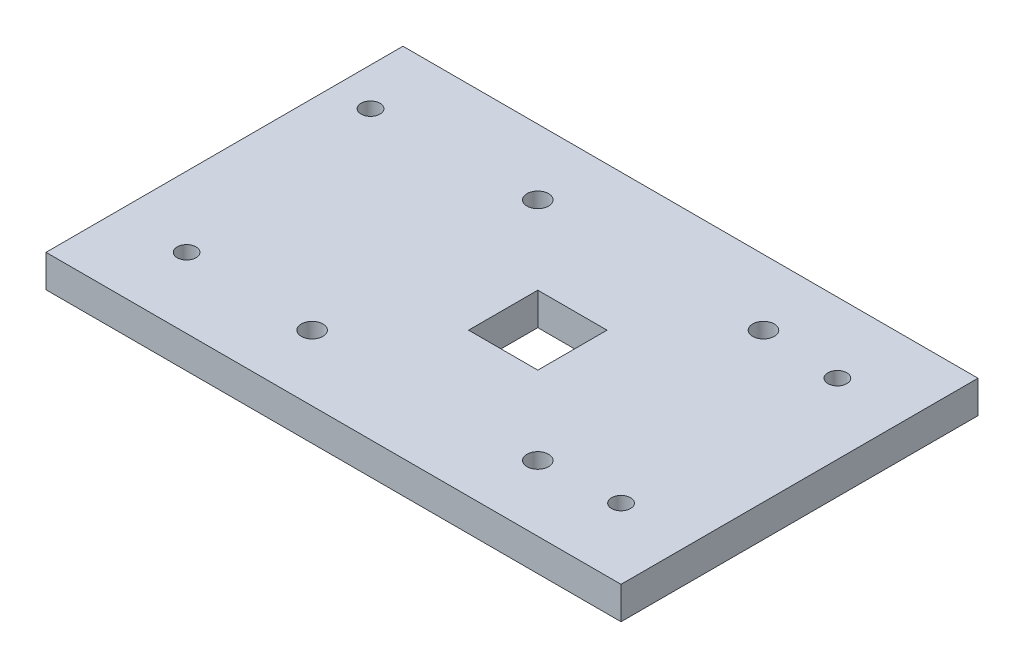
from build123d import *

# Parameters (mm, degrees)
SKETCH1_W           = 106.32
SKETCH1_H           = 66
SKETCH1_R           = 2
SKETCH1_W_2         = 12.8
SKETCH1_H_2         = 12.8
BOSS_EXTRUDE1_DEPTH = 6
SKETCH4_R           = 1.75
CUT_EXTRUDE1_DEPTH  = 67.939412158


with BuildPart() as part:
    # Sketch1 → Boss-Extrude1 (new body)
    with BuildSketch(Plane(origin=(0, 0, 0), x_dir=(1, 0, 0), z_dir=(0, 1, 0))):
        with Locations((-4.77, 0)):
            Rectangle(SKETCH1_W, SKETCH1_H)
        with Locations((20.86254326, -20.86254326)):
            Circle(SKETCH1_R, mode=Mode.SUBTRACT)
        with Locations((20.86254326, 20.86254326)):
            Circle(SKETCH1_R, mode=Mode.SUBTRACT)
        with Locations((-20.86254326, -20.86254326)):
            Circle(SKETCH1_R, mode=Mode.SUBTRACT)
        with Locations((-20.86254326, 20.86254326)):
            Circle(SKETCH1_R, mode=Mode.SUBTRACT)
        Rectangle(SKETCH1_W_2, SKETCH1_H_2, mode=Mode.SUBTRACT)
    extrude(amount=BOSS_EXTRUDE1_DEPTH)

    # Sketch4 → Cut-Extrude1 (cut, through all)
    with BuildSketch(Plane(origin=(0, 6, 0), x_dir=(1, 0, 0), z_dir=(0, 1, 0))):
        with Locations((-50.93, 20)):
            Circle(SKETCH4_R)
        with Locations((-44.93, -20)):
            Circle(SKETCH4_R)
        with Locations((35.39, -20)):
            Circle(SKETCH4_R)
        with Locations((35.39, 20)):
            Circle(SKETCH4_R)
    extrude(amount=-CUT_EXTRUDE1_DEPTH, mode=Mode.SUBTRACT)


solid = part.part
